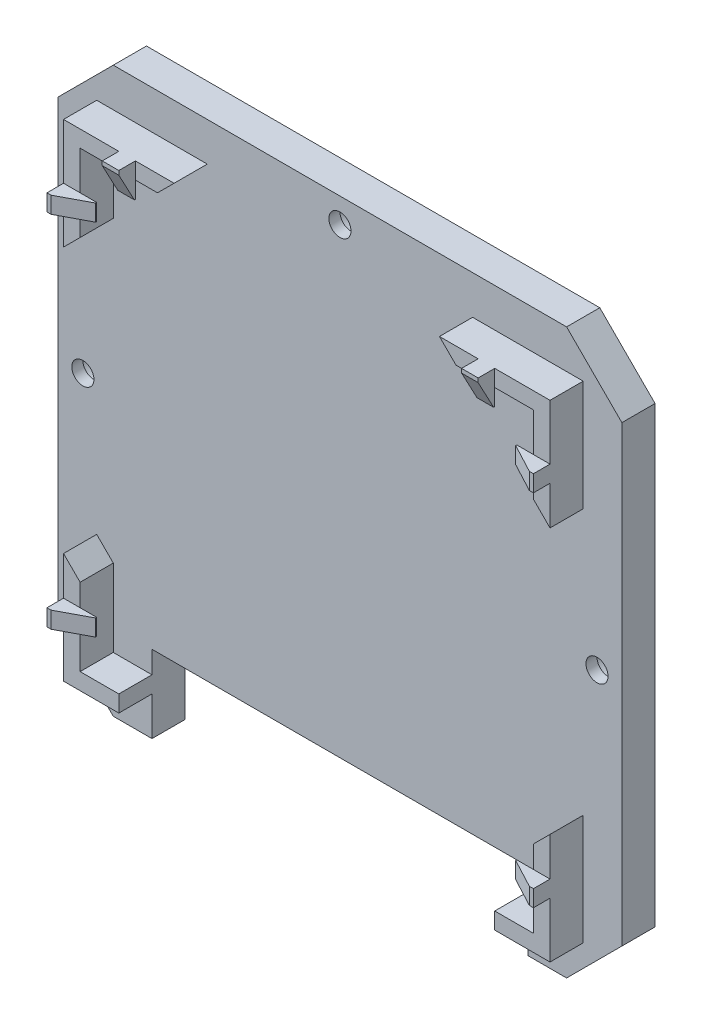
from build123d import *
from OCP.BRepFilletAPI import BRepFilletAPI_MakeChamfer

# Parameters (mm, degrees)
BOSS_EXTRU_1_DEPTH           = 3
BOSS_EXTRU_2_DEPTH           = 3
ENL_V_MAT_EXTRU_1_DEPTH      = 69.745908969
ENL_V_MAT_EXTRU_1_DEPTH_BACK = 69.745908969
ESQUISSE3_W                  = 34
ESQUISSE3_H                  = 7
ESQUISSE4_R                  = 1.75
ENL_V_MAT_EXTRU_2_DEPTH      = 2
ESQUISSE5_R                  = 1
ENL_V_MAT_EXTRU_3_DEPTH      = 1
ESQUISSE6_W                  = 1.5
ESQUISSE6_H                  = 3
ESQUISSE6_W_2                = 3
ESQUISSE6_H_2                = 1.5
BOSS_EXTRU_3_DEPTH           = 1.5
CHANFREIN1_SIZE              = 1.4
CHANFREIN1_SIZE2             = 2.633017051
SYM_TRIE1_START              = 3.5
SYM_TRIE1_DEPTH              = 1.5


# Read off the part's stored shape, not the designer's step: Symétrie1
with BuildPart() as part:
    # Esquisse1 → Boss.-Extru.1 (new body)
    with BuildSketch(Plane.XY):
        Polygon((0, 0), (5, -5), (46, -5), (51, 0), (51, 41), (46, 46), (5, 46), (0, 41), align=None)
    extrude(amount=BOSS_EXTRU_1_DEPTH)

    # Esquisse2 → Boss.-Extru.2 (add)
    with BuildSketch(Plane.XY.offset(3)):
        Polygon((5, 41), (5, 34), (3.5, 32.5), (3.5, 42.5), (13.5, 42.5), (12, 41), align=None)
        Polygon((3.5, -1.5), (13.5, -1.5), (12, 0), (5, 0), (5, 7), (3.5, 8.5), align=None)
        Polygon((47.5, 42.5), (47.5, 32.5), (46, 34), (46, 41), (39, 41), (37.5, 42.5), align=None)
        Polygon((46, 7), (46, 0), (39, 0), (37.5, -1.5), (47.5, -1.5), (47.5, 8.5), align=None)
    extrude(amount=BOSS_EXTRU_2_DEPTH)

    # Esquisse3 → Enlèv. mat.-Extru.1 (cut, two sides: drawn at the far end of the back side and taken through both)
    with BuildSketch(Plane.XY.offset(3).offset(-ENL_V_MAT_EXTRU_1_DEPTH_BACK)):
        with Locations((25.5, -1.5)):
            Rectangle(ESQUISSE3_W, ESQUISSE3_H)
    extrude(amount=ENL_V_MAT_EXTRU_1_DEPTH + ENL_V_MAT_EXTRU_1_DEPTH_BACK, mode=Mode.SUBTRACT)

    # Esquisse4 → Enlèv. mat.-Extru.2 (cut)
    with BuildSketch(Plane(origin=(0, 0, 0), x_dir=(-1, 0, 0), z_dir=(0, 0, -1))):
        with Locations((-25.5, 43.75)):
            Circle(ESQUISSE4_R)
        with Locations((-48.75, 20.5)):
            Circle(ESQUISSE4_R)
        with Locations((-2.25, 20.5)):
            Circle(ESQUISSE4_R)
    extrude(amount=-ENL_V_MAT_EXTRU_2_DEPTH, mode=Mode.SUBTRACT)

    # Esquisse5 → Enlèv. mat.-Extru.3 (cut)
    with BuildSketch(Plane(origin=(0, 0, 2), x_dir=(-1, 0, 0), z_dir=(0, 0, -1))):
        with Locations((-25.5, 43.75)):
            Circle(ESQUISSE5_R)
        with Locations((-2.25, 20.5)):
            Circle(ESQUISSE5_R)
        with Locations((-48.75, 20.5)):
            Circle(ESQUISSE5_R)
    extrude(amount=-ENL_V_MAT_EXTRU_3_DEPTH, mode=Mode.SUBTRACT)

    # Esquisse6 → Boss.-Extru.3 (add)
    with BuildSketch(Plane.XY.offset(6)):
        with Locations((9.25, 41)):
            Rectangle(ESQUISSE6_W, ESQUISSE6_H)
        with Locations((41.75, 41)):
            Rectangle(ESQUISSE6_W, ESQUISSE6_H)
        with Locations((5, 36.75)):
            Rectangle(ESQUISSE6_W_2, ESQUISSE6_H_2)
        with Locations((46, 36.75)):
            Rectangle(ESQUISSE6_W_2, ESQUISSE6_H_2)
    extrude(amount=BOSS_EXTRU_3_DEPTH)

    # Chanfrein1: one chamfer whose edges measure the first distance from different faces: ONE call of the kernel's chamfer builder (chamfer() names one face for all edges)
    chanfrein1_edges_1 = [part.edges().sort_by_distance(p)[0] for p in [
        (9.25, 39.5, 7.5),
    ]]
    chanfrein1_side_1 = [part.faces().sort_by_distance(p)[0] for p in [
        (9.25, 39.5, 6.75),
    ]]
    chanfrein1_edges_2 = [part.edges().sort_by_distance(p)[0] for p in [
        (41.75, 39.5, 7.5),
    ]]
    chanfrein1_side_2 = [part.faces().sort_by_distance(p)[0] for p in [
        (41.75, 39.5, 6.75),
    ]]
    chanfrein1_edges_3 = [part.edges().sort_by_distance(p)[0] for p in [
        (6.5, 36.75, 7.5),
    ]]
    chanfrein1_side_3 = [part.faces().sort_by_distance(p)[0] for p in [
        (6.5, 36.75, 6.75),
    ]]
    chanfrein1_edges_4 = [part.edges().sort_by_distance(p)[0] for p in [
        (44.5, 36.75, 7.5),
    ]]
    chanfrein1_side_4 = [part.faces().sort_by_distance(p)[0] for p in [
        (44.5, 36.75, 6.75),
    ]]
    chanfrein1 = BRepFilletAPI_MakeChamfer(part.part.solid().wrapped)
    for e in chanfrein1_edges_1:
        chanfrein1.Add(CHANFREIN1_SIZE, CHANFREIN1_SIZE2, e.wrapped, chanfrein1_side_1[0].wrapped)  # the first distance lies on this face
    for e in chanfrein1_edges_2:
        chanfrein1.Add(CHANFREIN1_SIZE, CHANFREIN1_SIZE2, e.wrapped, chanfrein1_side_2[0].wrapped)  # the first distance lies on this face
    for e in chanfrein1_edges_3:
        chanfrein1.Add(CHANFREIN1_SIZE, CHANFREIN1_SIZE2, e.wrapped, chanfrein1_side_3[0].wrapped)  # the first distance lies on this face
    for e in chanfrein1_edges_4:
        chanfrein1.Add(CHANFREIN1_SIZE, CHANFREIN1_SIZE2, e.wrapped, chanfrein1_side_4[0].wrapped)  # the first distance lies on this face
    add(Compound.cast(chanfrein1.Shape()), mode=Mode.REPLACE)

    # Symétrie1 outline → Symétrie1 (add)
    with BuildSketch(Plane(origin=(0, 0, 0), x_dir=(1, 0, 0), z_dir=(0, 1, 0)).offset(SYM_TRIE1_START)):
        Polygon((3.5, -6), (3.5, -7.5), (3.866982949, -7.5), (6.5, -6.1), (6.5, -6), align=None)
        Polygon((47.5, -6), (44.5, -6), (44.5, -6.1), (47.133017051, -7.5), (47.5, -7.5), align=None)
    extrude(amount=SYM_TRIE1_DEPTH)


solid = part.part
